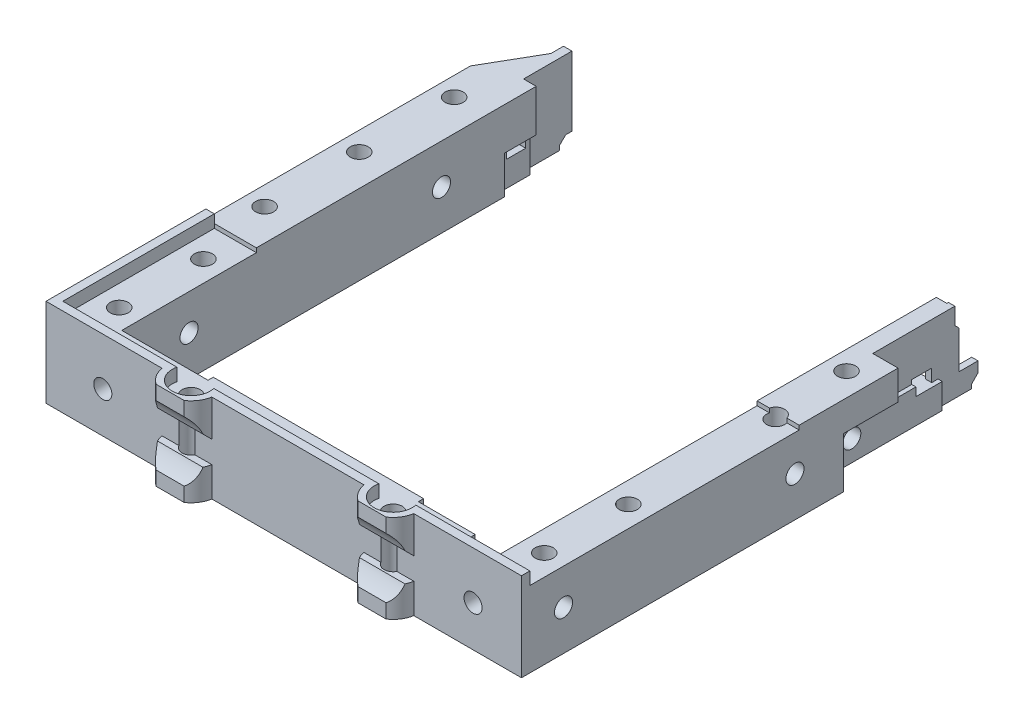
from build123d import *

# Parameters (mm, degrees)
EXTRUDE_1_DEPTH                  = 18
SKETCH_3_R                       = 2.15
CUT_EXTRUDE_1_DEPTH              = 110.787294347
SKETCH_4_W                       = 7.5
SKETCH_4_H                       = 18
CUT_EXTRUDE_2_DEPTH              = 6
CUT_EXTRUDE_3_REACH              = 147.925
SKETCH_5_W                       = 15
SKETCH_5_H                       = 12
CUT_EXTRUDE_4_REACH              = 143.414
SKETCH_6_W                       = 2
SKETCH_6_H                       = 9
SKETCH_7_W                       = 10
SKETCH_7_H                       = 61
EXTRUDE_2_DEPTH                  = 1
SKETCH_8_W                       = 61
SKETCH_8_H                       = 19
EXTRUDE_3_DEPTH                  = 4
SKETCH_9_W                       = 42
SKETCH_9_H                       = 19
EXTRUDE_4_DEPTH                  = 2
SKETCH_10_R                      = 2.15
CUT_EXTRUDE_5_DEPTH              = 6
SKETCH_11_W                      = 50
SKETCH_11_H                      = 18
EXTRUDE_5_DEPTH                  = 1.25
EXTRUDE_START                    = 1
SKETCH_12_R                      = 2.15
EXTRUDE_6_DEPTH                  = 1
SKETCH_13_W                      = 7
SKETCH_13_H                      = 2
CUT_EXTRUDE_6_DEPTH              = 18
CUT_EXTRUDE_7_DEPTH              = 112.862638982
CUT_EXTRUDE_7_DEPTH_BACK         = 112.862638982
EXTRUDE_7_DEPTH                  = 1
SKETCH_18_R                      = 2.15
CUT_EXTRUDE_8_DEPTH              = 6
SKETCH_19_R                      = 2.15
CUT_EXTRUDE_9_DEPTH              = 112.055166471
CUT_EXTRUDE_10_DEPTH             = 112.167666162
CUT_EXTRUDE_10_DEPTH_BACK        = 112.167666162
SKETCH_20_R                      = 2.15
SKETCH_23_W                      = 2
SKETCH_23_H                      = 19
CUT_EXTRUDE_11_DEPTH             = 88.305498109
EXTRUDE_10_DEPTH                 = 3
CUT_EXTRUDE_13_DEPTH             = 1.5
EXTRUDE_11_DEPTH                 = 1
SKETCH_29_W                      = 4.158947633
SKETCH_29_H                      = 12
EXTRUDE_12_DEPTH                 = 1
FILLET_1_R                       = 1
CUT_EXTRUDE_14_REACH             = 154.509
EXTRUDE_13_DEPTH                 = 1.5
EXTRUDE_14_REACH                 = 155.565
SKETCH_32_W                      = 1.75
SKETCH_32_H                      = 3
CHAMFER_1_SIZE2                  = 1
CHAMFER_1_SIZE                   = 1.732050808
SKETCH_33_R                      = 2.15
EXTRUDE_16_DEPTH                 = 19
CUT_EXTRUDE_15_REACH             = 126.256
SKETCH_34_R                      = 2.15
EXTRUDE_18_DEPTH                 = 12
CUT_EXTRUDE_16_DEPTH             = 1.75
SKETCH_39_W                      = 19
SKETCH_39_H                      = 9
CUT_EXTRUDE_17_DEPTH             = 1.5
CHAMFER_2_SIZE                   = 1.5
CUT_EXTRUDE_18_DEPTH             = 1.5
CUT_EXTRUDE_18_DEPTH_BACK        = 1.5
SKETCH_40_W                      = 11.5
SKETCH_40_H                      = 19
CUT_EXTRUDE_19_DEPTH             = 7
CHAMFER_3_SIZE                   = 7
CHAMFER_3_SIZE_2                 = 12.124355653
CUT_EXTRUDE_20_REACH             = 126.524
SKETCH_43_W                      = 4.5
SKETCH_43_H                      = 7
CUT_EXTRUDE_21_DEPTH             = 0.7
FILLET_2_R                       = 2
CUT_EXTRUDE_22_REACH             = 156.145
CUT_EXTRUDE_22_DIRECTION_2_REACH = 156.145
EXTRUDE_19_DEPTH                 = 0.7
SKETCH_46_W                      = 0.5
SKETCH_46_H                      = 3
EXTRUDE_20_DEPTH                 = 1.5
SKETCH_47_W                      = 1
SKETCH_47_H                      = 3
EXTRUDE_21_DEPTH                 = 4.5
CUT_EXTRUDE_23_REACH             = 156.629
SKETCH_48_W                      = 2
SKETCH_48_H                      = 11
FILLET_3_R                       = 0.5
EXTRUDE_22_DEPTH                 = 2.5
SKETCH_50_W                      = 2.5
SKETCH_50_H                      = 8
EXTRUDE_23_DEPTH                 = 1.5
CUT_EXTRUDE_24_REACH             = 155.594
SKETCH_51_W                      = 1
SKETCH_51_H                      = 5
CHAMFER_4_SIZE                   = 1
EXTRUDE_25_DEPTH                 = 12
CUT_EXTRUDE_25_REACH             = 157.322
SKETCH_53_R                      = 2.15
CUT_EXTRUDE_26_REACH             = 127.568
SKETCH_54_R                      = 2.15
SKETCH_55_R                      = 2.15
CUT_EXTRUDE_27_DEPTH             = 12
SKETCH_56_R                      = 2.15
CUT_EXTRUDE_28_DEPTH             = 10
CUT_EXTRUDE_29_REACH             = 160.84
SKETCH_57_R                      = 10
CUT_EXTRUDE_30_REACH             = 160.84
SKETCH_58_W                      = 1.6
SKETCH_58_H                      = 6.823488844
CHAMFER_5_SIZE                   = 1.6
EXTRUDE_26_DEPTH                 = 2
EXTRUDE_27_DEPTH                 = 3
CUT_EXTRUDE_31_REACH             = 133.161
SKETCH_61_R                      = 2.15
SKETCH_62_W                      = 7.75
SKETCH_62_H                      = 2
EXTRUDE_28_DEPTH                 = 1


# Some blends are built 0.0001 mm under size
with BuildPart() as part:
    # 草图2 → 凸台-拉伸1 (new body)
    with BuildSketch(Plane(origin=(0, 0, 0), x_dir=(1, 0, 0), z_dir=(0, 1, 0))):
        Polygon((-45.5, 0), (45.5, 0), (45.5, 93), (55.5, 93), (55.5, -10), (-55.5, -10), (-55.5, 93), (-45.5, 93), align=None)
    extrude(amount=EXTRUDE_1_DEPTH)

    # 草图3 → 切除-拉伸1 (cut, through all)
    with BuildSketch(Plane(origin=(0, 18, 0), x_dir=(1, 0, 0), z_dir=(0, 1, 0))):
        with Locations(Location((50, 76.75, 0), (0, 0, 270))):
            Circle(SKETCH_3_R)
    extrude(amount=-CUT_EXTRUDE_1_DEPTH, mode=Mode.SUBTRACT)

    # 草图4 → 切除-拉伸2 (cut)
    with BuildSketch(Plane(origin=(55.5, 0, 0), x_dir=(0, 0, -1), z_dir=(1, 0, 0))):
        with Locations((89.25, 9)):
            Rectangle(SKETCH_4_W, SKETCH_4_H)
    extrude(amount=-CUT_EXTRUDE_2_DEPTH, mode=Mode.SUBTRACT)

    # 切除-拉伸3: up to this face of the body (flat: up to its plane)
    cut_extrude_3_end = Plane(part.part.faces().sort_by_distance((49.5, 9, -89.25))[0])
    # 草图5 → 切除-拉伸3 (cut, up to the picked face)
    with BuildSketch(Plane(origin=(55.5, 0, 0), x_dir=(0, 0, -1), z_dir=(1, 0, 0)), mode=Mode.PRIVATE) as cut_extrude_3_sk1:
        with Locations((78, 6)):
            Rectangle(SKETCH_5_W, SKETCH_5_H)
    cut_extrude_3_tool1 = split(extrude(cut_extrude_3_sk1.sketch, amount=-CUT_EXTRUDE_3_REACH, mode=Mode.PRIVATE), bisect_by=cut_extrude_3_end, keep=Keep.BOTH, mode=Mode.PRIVATE)
    add(cut_extrude_3_tool1.solids().sort_by(Axis((55.5, 6, -78), (-1, 0, 0)))[0], mode=Mode.SUBTRACT)

    # 草图6 → 切除-拉伸4 (cut, up to next)
    with BuildSketch(Plane(origin=(49.5, 0, 0), x_dir=(0, 0, -1), z_dir=(1, 0, 0)), mode=Mode.PRIVATE) as cut_extrude_4_sk1:
        with Locations((92, 4.5)):
            Rectangle(SKETCH_6_W, SKETCH_6_H)
    cut_extrude_4_tool1 = extrude(cut_extrude_4_sk1.sketch, amount=-CUT_EXTRUDE_4_REACH, mode=Mode.PRIVATE) & part.part
    add(cut_extrude_4_tool1.solids().sort_by_distance((49.5, 4.5, -92))[0], mode=Mode.SUBTRACT)

    # 草图7 → 凸台-拉伸2 (add)
    with BuildSketch(Plane(origin=(0, 18, 0), x_dir=(1, 0, 0), z_dir=(0, 1, 0))):
        with Locations((-50.5, 62.5)):
            Rectangle(SKETCH_7_W, SKETCH_7_H)
    extrude(amount=EXTRUDE_2_DEPTH)

    # 草图8 → 凸台-拉伸3 (add)
    with BuildSketch(Plane.ZY.offset(55.5)):
        with Locations((-62.5, 9.5)):
            Rectangle(SKETCH_8_W, SKETCH_8_H)
    extrude(amount=EXTRUDE_3_DEPTH)

    # 草图9 → 凸台-拉伸4 (add)
    with BuildSketch(Plane.ZY.offset(55.5)):
        with Locations((-11, 9.5)):
            Rectangle(SKETCH_9_W, SKETCH_9_H)
    extrude(amount=EXTRUDE_4_DEPTH)

    # 草图10 → 切除-拉伸5 (cut)
    with BuildSketch(Plane(origin=(0, 18, 0), x_dir=(1, 0, 0), z_dir=(0, 1, 0))):
        with Locations(Location((-50.5, 4.4, 0), (0, 0, 270))):
            Circle(SKETCH_10_R)
        with Locations(Location((-50.5, 24.4, 0), (0, 0, 270))):
            Circle(SKETCH_10_R)
        with Locations(Location((-24, -5, 0), (0, 0, 270))):
            Circle(SKETCH_10_R)
        with Locations(Location((24, -5, 0), (0, 0, 270))):
            Circle(SKETCH_10_R)
    extrude(amount=-CUT_EXTRUDE_5_DEPTH, mode=Mode.SUBTRACT)

    # 草图11 → 凸台-拉伸5 (add)
    with BuildSketch(Plane(origin=(0, 0, 0), x_dir=(-1, 0, 0), z_dir=(0, 0, -1))):
        with Locations((0, 9)):
            Rectangle(SKETCH_11_W, SKETCH_11_H)
    extrude(amount=EXTRUDE_5_DEPTH)

    # 草图12 → 凸台-拉伸6 (add)
    with BuildSketch(Plane(origin=(0, 18, 0), x_dir=(1, 0, 0), z_dir=(0, 1, 0)).offset(EXTRUDE_START)):
        Polygon((49.5, 93), (45.5, 93), (45.5, 60), (55.5, 60), (55.5, 85.5), (49.5, 85.5), align=None)
        with Locations(Location((50, 76.75, 0), (0, 0, 270))):
            Circle(SKETCH_12_R, mode=Mode.SUBTRACT)
    extrude(amount=-EXTRUDE_6_DEPTH)

    # 草图13 → 切除-拉伸6 (cut)
    with BuildSketch(Plane(origin=(0, 18, 0), x_dir=(1, 0, 0), z_dir=(0, 1, 0))):
        with Locations((42, -1)):
            Rectangle(SKETCH_13_W, SKETCH_13_H)
    extrude(amount=-CUT_EXTRUDE_6_DEPTH, mode=Mode.SUBTRACT)

    # 草图14 → 切除-拉伸7 (cut, two sides: drawn at the far end of the back side and taken through both)
    with BuildSketch(Plane(origin=(0, 18, 0), x_dir=(1, 0, 0), z_dir=(0, 1, 0)).offset(-CUT_EXTRUDE_7_DEPTH_BACK)):
        with BuildLine():
            Line((-57.5, -10), (-27.31662479, -10))
            ThreePointArc((-27.31662479, -10), (-29.030974899, -8.269448205), (-29.916079783, -6))
            Line((-29.916079783, -6), (-57.5, -6))
            Line((-57.5, -6), (-57.5, -10))
        make_face()
        with BuildLine():
            Line((55.5, -10), (55.5, -6))
            Line((55.5, -6), (29.916079783, -6))
            ThreePointArc((29.916079783, -6), (29.030974899, -8.269448205), (27.31662479, -10))
            Line((27.31662479, -10), (55.5, -10))
        make_face()
        with BuildLine():
            Line((-18.083920217, -6), (18.083920217, -6))
            ThreePointArc((18.083920217, -6), (18.969025101, -8.269448205), (20.68337521, -10))
            Line((20.68337521, -10), (-20.68337521, -10))
            ThreePointArc((-20.68337521, -10), (-18.969025101, -8.269448205), (-18.083920217, -6))
        make_face()
    extrude(amount=CUT_EXTRUDE_7_DEPTH + CUT_EXTRUDE_7_DEPTH_BACK, mode=Mode.SUBTRACT)

    # 草图16 → 凸台-拉伸7 (add)
    with BuildSketch(Plane(origin=(0, 18, 0), x_dir=(1, 0, 0), z_dir=(0, 1, 0))):
        with BuildLine():
            Line((-55.5, -6), (-29.916079783, -6))
            ThreePointArc((-29.916079783, -6), (-30, -5), (-29.916079783, -4))
            Line((-29.916079783, -4), (-55.5, -4))
            Line((-55.5, -4), (-55.5, -6))
        make_face()
        with BuildLine():
            Line((55.5, -6), (55.5, -4))
            Line((55.5, -4), (29.916079783, -4))
            ThreePointArc((29.916079783, -4), (30, -5), (29.916079783, -6))
            Line((29.916079783, -6), (55.5, -6))
        make_face()
        with BuildLine():
            Line((-18.083920217, -4), (18.083920217, -4))
            ThreePointArc((18.083920217, -4), (18, -5), (18.083920217, -6))
            Line((18.083920217, -6), (-18.083920217, -6))
            ThreePointArc((-18.083920217, -6), (-18, -5), (-18.083920217, -4))
        make_face()
    extrude(amount=EXTRUDE_7_DEPTH)

    # 草图18 → 切除-拉伸8 (cut)
    with BuildSketch(Plane(origin=(0, 19, 0), x_dir=(1, 0, 0), z_dir=(0, 1, 0))):
        with Locations(Location((-53, 86.45, 0), (0, 0, 270))):
            Circle(SKETCH_18_R)
        with Locations(Location((-53, 63.95, 0), (0, 0, 270))):
            Circle(SKETCH_18_R)
        with Locations(Location((-53, 41.45, 0), (0, 0, 270))):
            Circle(SKETCH_18_R)
    extrude(amount=-CUT_EXTRUDE_8_DEPTH, mode=Mode.SUBTRACT)

    # 草图19 → 切除-拉伸9 (cut, through all)
    with BuildSketch(Plane(origin=(0, 12, 0), x_dir=(1, 0, 0), z_dir=(0, 1, 0))):
        with Locations(Location((24, -5, 0), (0, 0, 270))):
            Circle(SKETCH_19_R)
        with Locations(Location((-24, -5, 0), (0, 0, 270))):
            Circle(SKETCH_19_R)
    extrude(amount=-CUT_EXTRUDE_9_DEPTH, mode=Mode.SUBTRACT)

    # 草图20 → 切除-拉伸10 (cut, two sides: drawn at the far end of the back side and taken through both)
    with BuildSketch(Plane(origin=(0, 13, 0), x_dir=(1, 0, 0), z_dir=(0, 1, 0)).offset(-CUT_EXTRUDE_10_DEPTH_BACK)):
        with Locations(Location((-50.5, 4.4, 0), (0, 0, 270))):
            Circle(SKETCH_20_R)
        with Locations(Location((-50.5, 24.4, 0), (0, 0, 270))):
            Circle(SKETCH_20_R)
        with Locations(Location((-53, 41.45, 0), (0, 0, 270))):
            Circle(SKETCH_20_R)
        with Locations(Location((-53, 63.95, 0), (0, 0, 270))):
            Circle(SKETCH_20_R)
        with Locations(Location((-53, 86.45, 0), (0, 0, 270))):
            Circle(SKETCH_20_R)
        with Locations(Location((50.5, 24.4, 0), (0, 0, 270))):
            Circle(SKETCH_20_R)
        with Locations(Location((50.5, 4.4, 0), (0, 0, 270))):
            Circle(SKETCH_20_R)
    extrude(amount=CUT_EXTRUDE_10_DEPTH + CUT_EXTRUDE_10_DEPTH_BACK, mode=Mode.SUBTRACT)

    # 草图23 → 切除-拉伸11 (cut, through all)
    with BuildSketch(Plane.XY.offset(-32)):
        with Locations((-58.5, 9.5)):
            Rectangle(SKETCH_23_W, SKETCH_23_H)
    extrude(amount=-CUT_EXTRUDE_11_DEPTH, mode=Mode.SUBTRACT)

    # 草图26 → 凸台-拉伸10 (add)
    with BuildSketch(Plane(origin=(49.5, 0, 0), x_dir=(0, 0, -1), z_dir=(1, 0, 0))):
        Polygon((91, 0), (91, 6), (98, 6), (98, 9), (93, 9), (93, 19), (107, 19), (107, 0), align=None)
    extrude(amount=-EXTRUDE_10_DEPTH)

    # 草图27 → 切除-拉伸13 (cut)
    with BuildSketch(Plane.ZY.offset(-46.5)):
        Polygon((-98, 13), (-98, 0), (-107, 0), (-107, 19), (-101.464101615, 19), align=None)
    extrude(amount=-CUT_EXTRUDE_13_DEPTH, mode=Mode.SUBTRACT)

    # 草图28 → 凸台-拉伸11 (add)
    with BuildSketch(Plane.ZY.offset(-46.5)):
        Polygon((-101.464101615, 19), (-98, 13), (-98, 9), (-93, 9), (-93, 19), align=None)
    extrude(amount=EXTRUDE_11_DEPTH)

    # 草图29 → 凸台-拉伸12 (add)
    with BuildSketch(Plane(origin=(49.5, 0, 0), x_dir=(0, 0, -1), z_dir=(1, 0, 0))):
        Polygon((85.5, 12), (85.5, 6), (99, 6), (99, 0), (78.841052367, 0), (78.841052367, 12), align=None)
        with Locations((72.579473817, 6)):
            Rectangle(SKETCH_29_W, SKETCH_29_H)
    extrude(amount=EXTRUDE_12_DEPTH)

    # 圆角1
    fillet_1_edges = [part.edges().sort_by_distance(p)[0] for p in [
        (50, 6, -85.5),
    ]]
    fillet(fillet_1_edges, radius=FILLET_1_R)

    # 草图30 → 切除-拉伸14 (cut, up to next)
    with BuildSketch(Plane(origin=(49.5, 0, 0), x_dir=(0, 0, -1), z_dir=(1, 0, 0)), mode=Mode.PRIVATE) as cut_extrude_14_sk1:
        with BuildLine():
            Line((107, 11), (107, 19))
            Line((107, 19), (101.5, 19))
            Line((101.5, 19), (101.5, 12))
            ThreePointArc((101.5, 12), (101.792893219, 11.292893219), (102.5, 11))
            Line((102.5, 11), (107, 11))
        make_face()
    cut_extrude_14_tool1 = extrude(cut_extrude_14_sk1.sketch, amount=-CUT_EXTRUDE_14_REACH, mode=Mode.PRIVATE) & part.part
    add(cut_extrude_14_tool1.solids().sort_by_distance((49.5, 15.01851, -104.262384))[0], mode=Mode.SUBTRACT)

    # 草图31 → 凸台-拉伸13 (add)
    with BuildSketch(Plane(origin=(49.5, 0, 0), x_dir=(0, 0, -1), z_dir=(1, 0, 0))):
        Polygon((107, 1), (108.5, 2.5), (108.5, 11), (107, 11), align=None)
    extrude(amount=-EXTRUDE_13_DEPTH)

    # 凸台-拉伸14: up to this face of the body (flat: up to its plane)
    extrude_14_end = Plane(part.part.faces().sort_by_distance((45.5, 9.407551011, -47.316741338))[0])
    # 草图32 → 凸台-拉伸14 (add, up to the picked face)
    with BuildSketch(Plane(origin=(49.5, 0, 0), x_dir=(0, 0, -1), z_dir=(1, 0, 0)), mode=Mode.PRIVATE) as extrude_14_sk1:
        with Locations((91.875, 7.5)):
            Rectangle(SKETCH_32_W, SKETCH_32_H)
    extrude_14_tool1 = split(extrude(extrude_14_sk1.sketch, amount=-EXTRUDE_14_REACH, mode=Mode.PRIVATE), bisect_by=extrude_14_end, keep=Keep.BOTH, mode=Mode.PRIVATE)
    add(extrude_14_tool1.solids().sort_by(Axis((49.5, 7.5, -91.875), (-1, 0, 0)))[0])

    # 倒角1
    chamfer_1_edges = [part.edges().sort_by_distance(p)[0] for p in [
        (45.5, 6, -91.875),
    ]]
    chamfer_1_side = [part.faces().sort_by_distance(p)[0] for p in [
        (45.5, 6.02, -91.875),
    ]]
    chamfer(chamfer_1_edges, length=CHAMFER_1_SIZE - 0.0001, length2=CHAMFER_1_SIZE2 - 0.0001, reference=chamfer_1_side[0])  # a hair under: the kernel refuses the full size

    # 草图33 → 凸台-拉伸16 (add)
    with BuildSketch(Plane(origin=(0, 19, 0), x_dir=(1, 0, 0), z_dir=(0, 1, 0))):
        with Locations((-53, 86.45)):
            Circle(SKETCH_33_R)
    extrude(amount=-EXTRUDE_16_DEPTH)

    # 草图34 → 切除-拉伸15 (cut, up to next)
    with BuildSketch(Plane(origin=(0, 19, 0), x_dir=(1, 0, 0), z_dir=(0, 1, 0)), mode=Mode.PRIVATE) as cut_extrude_15_sk1:
        with Locations(Location((-53, 86.5, 0), (0, 0, 270))):
            Circle(SKETCH_34_R)
    cut_extrude_15_tool1 = extrude(cut_extrude_15_sk1.sketch, amount=-CUT_EXTRUDE_15_REACH, mode=Mode.PRIVATE) & part.part
    add(cut_extrude_15_tool1.solids().sort_by_distance((-53, 19, -86.5))[0], mode=Mode.SUBTRACT)

    # 草图36 → 凸台-拉伸18 (add)
    with BuildSketch(Plane.ZY.offset(57.5)):
        Polygon((-93, 6), (-98.5, 6), (-98.5, 9), (-93, 9), (-93, 19), (-110, 19), (-110, 2.5), (-108.5, 2.5), (-107, 1), (-107, 0), (-93, 0), align=None)
    extrude(amount=-EXTRUDE_18_DEPTH)

    # 草图38 → 切除-拉伸16 (cut)
    with BuildSketch(Plane(origin=(0, 0, -92.75), x_dir=(-1, 0, 0), z_dir=(0, 0, -1))):
        Polygon((-46.5, 6), (-46.5, 8), (-45.5, 9), (-45.5, 6), align=None)
    extrude(amount=-CUT_EXTRUDE_16_DEPTH, mode=Mode.SUBTRACT)

    # 草图39 → 切除-拉伸17 (cut)
    with BuildSketch(Plane(origin=(-45.5, 0, 0), x_dir=(0, 0, -1), z_dir=(1, 0, 0))):
        with Locations((100.5, 4.5)):
            Rectangle(SKETCH_39_W, SKETCH_39_H)
    extrude(amount=-CUT_EXTRUDE_17_DEPTH, mode=Mode.SUBTRACT)

    # 倒角2
    chamfer_2_edges = [part.edges().sort_by_distance(p)[0] for p in [
        (-47, 9, -92),
    ]]
    chamfer(chamfer_2_edges, length=CHAMFER_2_SIZE - 0.0001)  # a hair under: the kernel refuses the full size

    # 草图40 → 切除-拉伸18 (cut, two sides: drawn at the far end of the back side and taken through both)
    with BuildSketch(Plane(origin=(-47, 0, 0), x_dir=(0, 0, -1), z_dir=(1, 0, 0)).offset(-CUT_EXTRUDE_18_DEPTH_BACK)):
        with Locations((104.25, 9.5)):
            Rectangle(SKETCH_40_W, SKETCH_40_H)
    extrude(amount=CUT_EXTRUDE_18_DEPTH + CUT_EXTRUDE_18_DEPTH_BACK, mode=Mode.SUBTRACT)

    # 草图41 → 切除-拉伸19 (cut)
    with BuildSketch(Plane.ZY.offset(57.5)):
        Polygon((-107, 19), (-107, 0), (-110, 2.5), (-110, 19), align=None)
    extrude(amount=-CUT_EXTRUDE_19_DEPTH, mode=Mode.SUBTRACT)

    # 倒角3
    # the kernel refuses this chamfer: 12.124355653, 7 mm, written as the material it takes off along each edge
    with BuildSketch(Plane(origin=(-57.5, -31.366747794, -107), x_dir=(0.9983227437537926, 0, -0.05789386240267121), z_dir=(0, 1, 0))) as chamfer_3_piece_1:
        Polygon((CHAMFER_3_SIZE * 0.998322743754, -CHAMFER_3_SIZE * 0.0578938624027), (-CHAMFER_3_SIZE_2 * 0.0578938624026, -CHAMFER_3_SIZE_2 * 0.998322743752), (0, 0), align=None)
    extrude(amount=81.733495588, mode=Mode.SUBTRACT)

    # 草图42 → 切除-拉伸20 (cut, up to next)
    with BuildSketch(Plane.XZ.offset(-9), mode=Mode.PRIVATE) as cut_extrude_20_sk1:
        Polygon((-51.5, -93), (-51.5, -105.267949192), (-57.5, -94.875644347), (-57.5, -93), align=None)
    cut_extrude_20_tool1 = extrude(cut_extrude_20_sk1.sketch, amount=CUT_EXTRUDE_20_REACH, mode=Mode.PRIVATE) & part.part
    add(cut_extrude_20_tool1.solids().sort_by_distance((-53.765229, 9, -97.172229))[0], mode=Mode.SUBTRACT)

    # 草图43 → 切除-拉伸21 (cut)
    with BuildSketch(Plane(origin=(49.5, 0, 0), x_dir=(0, 0, -1), z_dir=(1, 0, 0))):
        with Locations((106.25, 7.5)):
            Rectangle(SKETCH_43_W, SKETCH_43_H)
    extrude(amount=-CUT_EXTRUDE_21_DEPTH, mode=Mode.SUBTRACT)

    # 圆角2
    fillet_2_edges = [part.edges().sort_by_distance(p)[0] for p in [
        (49.15, 4, -104),
    ]]
    fillet(fillet_2_edges, radius=FILLET_2_R)

    # 草图44 → 切除-拉伸22 (cut, up to next)
    with BuildSketch(Plane(origin=(48.8, 0, 0), x_dir=(0, 0, -1), z_dir=(1, 0, 0)), mode=Mode.PRIVATE) as cut_extrude_22_sk1:
        Polygon((108.5, 5), (104, 5), (104, 6), (104, 11), (108.5, 11), align=None)
    cut_extrude_22_tool1 = extrude(cut_extrude_22_sk1.sketch, amount=-CUT_EXTRUDE_22_REACH, mode=Mode.PRIVATE) & part.part
    add(cut_extrude_22_tool1.solids().sort_by_distance((48.8, 8, -106.25))[0], mode=Mode.SUBTRACT)

    # 草图44 → 切除-拉伸22 direction 2 (cut, up to next)
    with BuildSketch(Plane(origin=(48.8, 0, 0), x_dir=(0, 0, -1), z_dir=(1, 0, 0)), mode=Mode.PRIVATE) as cut_extrude_22_direction_2_sk1:
        Polygon((108.5, 5), (104, 5), (104, 6), (104, 11), (108.5, 11), align=None)
    cut_extrude_22_direction_2_tool1 = extrude(cut_extrude_22_direction_2_sk1.sketch, amount=CUT_EXTRUDE_22_DIRECTION_2_REACH, mode=Mode.PRIVATE) & part.part
    add(cut_extrude_22_direction_2_tool1.solids().sort_by_distance((48.8, 8, -106.25))[0], mode=Mode.SUBTRACT)

    # 草图45 → 凸台-拉伸19 (add)
    with BuildSketch(Plane(origin=(48.8, 0, 0), x_dir=(0, 0, -1), z_dir=(1, 0, 0))):
        with BuildLine():
            Line((108.5, 5), (104.267949192, 5))
            ThreePointArc((104.267949192, 5), (105, 4.267949192), (106, 4))
            Line((106, 4), (108.5, 4))
            Line((108.5, 4), (108.5, 5))
        make_face()
    extrude(amount=EXTRUDE_19_DEPTH)

    # 草图46 → 凸台-拉伸20 (add)
    with BuildSketch(Plane(origin=(49.5, 0, 0), x_dir=(0, 0, -1), z_dir=(1, 0, 0))):
        with Locations((97.75, 7.5)):
            Rectangle(SKETCH_46_W, SKETCH_46_H)
    extrude(amount=-EXTRUDE_20_DEPTH)

    # 草图47 → 凸台-拉伸21 (add)
    with BuildSketch(Plane.ZY.offset(51.5)):
        with Locations((-98, 7.5)):
            Rectangle(SKETCH_47_W, SKETCH_47_H)
    extrude(amount=-EXTRUDE_21_DEPTH)

    # 草图48 → 切除-拉伸23 (cut, up to next)
    with BuildSketch(Plane(origin=(49.5, 0, 0), x_dir=(0, 0, -1), z_dir=(1, 0, 0)), mode=Mode.PRIVATE) as cut_extrude_23_sk1:
        with Locations((84.5, 13.5)):
            Rectangle(SKETCH_48_W, SKETCH_48_H)
    cut_extrude_23_tool1 = extrude(cut_extrude_23_sk1.sketch, amount=CUT_EXTRUDE_23_REACH, mode=Mode.PRIVATE) & part.part
    add(cut_extrude_23_tool1.solids().sort_by_distance((49.5, 13.5, -84.5))[0], mode=Mode.SUBTRACT)

    # 圆角3
    fillet_3_edges = [part.edges().sort_by_distance(p)[0] for p in [
        (50, 8, -85.5),
        (50, 8, -83.5),
    ]]
    fillet(fillet_3_edges, radius=FILLET_3_R)

    # 草图49 → 凸台-拉伸22 (add)
    with BuildSketch(Plane.ZY.offset(-48)):
        Polygon((-98, 11), (-102.618802154, 19), (-101.464101615, 19), (-98, 13), align=None)
    extrude(amount=EXTRUDE_22_DEPTH)

    # 草图50 → 凸台-拉伸23 (add)
    with BuildSketch(Plane(origin=(49.5, 0, 0), x_dir=(0, 0, -1), z_dir=(1, 0, 0))):
        with Locations((102.75, 15)):
            Rectangle(SKETCH_50_W, SKETCH_50_H)
    extrude(amount=-EXTRUDE_23_DEPTH)

    # 草图51 → 切除-拉伸24 (cut, up to next)
    with BuildSketch(Plane.ZY.offset(-48), mode=Mode.PRIVATE) as cut_extrude_24_sk1:
        with Locations((-103.5, 16.5)):
            Rectangle(SKETCH_51_W, SKETCH_51_H)
    cut_extrude_24_tool1 = extrude(cut_extrude_24_sk1.sketch, amount=-CUT_EXTRUDE_24_REACH, mode=Mode.PRIVATE) & part.part
    add(cut_extrude_24_tool1.solids().sort_by_distance((48, 16.5, -103.5))[0], mode=Mode.SUBTRACT)

    # 倒角4
    chamfer_4_edges = [part.edges().sort_by_distance(p)[0] for p in [
        (48.75, 14, -103),
    ]]
    chamfer(chamfer_4_edges, length=CHAMFER_4_SIZE - 0.0001)  # a hair under: the kernel refuses the full size

    # 草图52 → 凸台-拉伸25 (add)
    with BuildSketch(Plane.XZ):
        with BuildLine():
            Line((50.5, -73.791960108), (50.5, -79.708039892))
            ThreePointArc((50.5, -79.708039892), (47, -76.75), (50.5, -73.791960108))
        make_face()
    extrude(amount=-EXTRUDE_25_DEPTH)

    # 草图53 → 切除-拉伸25 (cut, up to next)
    with BuildSketch(Plane(origin=(50.5, 0, 0), x_dir=(0, 0, -1), z_dir=(1, 0, 0)), mode=Mode.PRIVATE) as cut_extrude_25_sk1:
        with Locations((77.5, 5)):
            Circle(SKETCH_53_R)
    cut_extrude_25_tool1 = extrude(cut_extrude_25_sk1.sketch, amount=-CUT_EXTRUDE_25_REACH, mode=Mode.PRIVATE) & part.part
    add(cut_extrude_25_tool1.solids().sort_by_distance((50.5, 5, -77.5))[0], mode=Mode.SUBTRACT)

    # 草图54 → 切除-拉伸26 (cut, up to next)
    with BuildSketch(Plane.XZ, mode=Mode.PRIVATE) as cut_extrude_26_sk1:
        with Locations(Location((50.5, -59.4, 0), (0, 0, 270))):
            Circle(SKETCH_54_R)
    cut_extrude_26_tool1 = extrude(cut_extrude_26_sk1.sketch, amount=-CUT_EXTRUDE_26_REACH, mode=Mode.PRIVATE) & part.part
    add(cut_extrude_26_tool1.solids().sort_by_distance((50.5, 0, -59.4))[0], mode=Mode.SUBTRACT)

    # 草图55 → 切除-拉伸27 (cut)
    with BuildSketch(Plane.ZY.offset(57.5)):
        with Locations((-76, 9.5)):
            Circle(SKETCH_55_R)
        with Locations((-16, 9.5)):
            Circle(SKETCH_55_R)
    extrude(amount=-CUT_EXTRUDE_27_DEPTH, mode=Mode.SUBTRACT)

    # 草图56 → 切除-拉伸28 (cut)
    with BuildSketch(Plane(origin=(55.5, 0, 0), x_dir=(0, 0, -1), z_dir=(1, 0, 0))):
        with Locations((4, 9.5)):
            Circle(SKETCH_56_R)
        with Locations((59, 9.5)):
            Circle(SKETCH_56_R)
    extrude(amount=-CUT_EXTRUDE_28_DEPTH, mode=Mode.SUBTRACT)

    # 切除-拉伸29: up to this face of the body (flat: up to its plane)
    cut_extrude_29_end = Plane(part.part.faces().sort_by_distance((-57.5, 9.545118638, -43.966893837))[0])
    # 草图57 → 切除-拉伸29 (cut, up to the picked face)
    with BuildSketch(Plane(origin=(55.5, 0, 0), x_dir=(0, 0, -1), z_dir=(1, 0, 0)), mode=Mode.PRIVATE) as cut_extrude_29_sk1:
        with Locations((-17, 10.5)):
            Circle(SKETCH_57_R)
    cut_extrude_29_tool1 = split(extrude(cut_extrude_29_sk1.sketch, amount=-CUT_EXTRUDE_29_REACH, mode=Mode.PRIVATE), bisect_by=cut_extrude_29_end, keep=Keep.BOTH, mode=Mode.PRIVATE)
    add(cut_extrude_29_tool1.solids().sort_by(Axis((55.5, 10.5, 17), (-1, 0, 0)))[0], mode=Mode.SUBTRACT)

    # 切除-拉伸30: up to this face of the body (flat: up to its plane)
    cut_extrude_30_end = Plane(part.part.faces().sort_by_distance((-57.5, 9.545118638, -43.966893837))[0])
    # 草图58 → 切除-拉伸30 (cut, up to the picked face)
    with BuildSketch(Plane(origin=(55.5, 0, 0), x_dir=(0, 0, -1), z_dir=(1, 0, 0)), mode=Mode.PRIVATE) as cut_extrude_30_sk1:
        with Locations((-6.8, 10.5)):
            Rectangle(SKETCH_58_W, SKETCH_58_H)
    cut_extrude_30_tool1 = split(extrude(cut_extrude_30_sk1.sketch, amount=-CUT_EXTRUDE_30_REACH, mode=Mode.PRIVATE), bisect_by=cut_extrude_30_end, keep=Keep.BOTH, mode=Mode.PRIVATE)
    add(cut_extrude_30_tool1.solids().sort_by(Axis((55.5, 10.5, 6.8), (-1, 0, 0)))[0], mode=Mode.SUBTRACT)

    # 倒角5
    # the kernel refuses this chamfer: 1.6 mm, written as the material it adds along each edge
    with BuildSketch(Plane(origin=(-21.78859385, 13.911744422, 6), x_dir=(0, -0.9996219169112968, -0.027495876610586285), z_dir=(-1, 0, 0))) as chamfer_5_piece_1_section:
        Polygon((CHAMFER_5_SIZE * 0.999621916911, CHAMFER_5_SIZE * 0.0274958766106), (-CHAMFER_5_SIZE * 0.0274958766106, CHAMFER_5_SIZE * 0.999621916911), (0, 0), align=None)
    chamfer_5_piece_1 = extrude(amount=12.242178714, mode=Mode.PRIVATE)
    chamfer_5_piece_1 = chamfer_5_piece_1 - Plane(origin=(-24, 13.422836747, 5), x_dir=(0, 0, 1), z_dir=(0, 1, 0)) * Cylinder(2.15, 31, mode=Mode.PRIVATE)
    chamfer_5_piece_1 = chamfer_5_piece_1 - Plane(origin=(-26.722058285, 10.5, 17), x_dir=(0, 0, -1), z_dir=(1, 0, 0)) * Cylinder(10, 31, mode=Mode.PRIVATE)
    chamfer_5_piece_1 = chamfer_5_piece_1 & Plane(origin=(-24, 13.422836747, 5), x_dir=(-0.5527707983925657, 0, 0.8333333333333339), z_dir=(0, -1, 0)) * Cylinder(6, 31, mode=Mode.PRIVATE)
    add(chamfer_5_piece_1)
    with BuildSketch(Plane(origin=(-13.969227436, 13.911744422, 6), x_dir=(0, -0.9996219169112968, -0.027495876610586285), z_dir=(-1, 0, 0))) as chamfer_5_piece_2_section:
        Polygon((CHAMFER_5_SIZE * 0.999621916911, CHAMFER_5_SIZE * 0.0274958766106), (-CHAMFER_5_SIZE * 0.0274958766106, CHAMFER_5_SIZE * 0.999621916911), (0, 0), align=None)
    chamfer_5_piece_2 = extrude(amount=12.242178714, mode=Mode.PRIVATE)
    chamfer_5_piece_2 = chamfer_5_piece_2 - Plane(origin=(-24, 13.422836749, 5), x_dir=(0, 0, 1), z_dir=(0, 1, 0)) * Cylinder(2.15, 31, mode=Mode.PRIVATE)
    chamfer_5_piece_2 = chamfer_5_piece_2 & Plane(origin=(-24, 13.422836749, 5), x_dir=(0.5527707983925676, 0, 0.8333333333333327), z_dir=(0, -1, 0)) * Cylinder(6, 31, mode=Mode.PRIVATE)
    chamfer_5_piece_2 = chamfer_5_piece_2 - Plane(origin=(-21.277941712, 10.5, 17), x_dir=(0, 0, -1), z_dir=(1, 0, 0)) * Cylinder(10, 31, mode=Mode.PRIVATE)
    add(chamfer_5_piece_2)
    with BuildSketch(Plane(origin=(26.21140615, 13.911744422, 6), x_dir=(0, -0.9996219169112968, -0.027495876610586285), z_dir=(-1, 0, 0))) as chamfer_5_piece_3_section:
        Polygon((CHAMFER_5_SIZE * 0.999621916911, CHAMFER_5_SIZE * 0.0274958766106), (-CHAMFER_5_SIZE * 0.0274958766106, CHAMFER_5_SIZE * 0.999621916911), (0, 0), align=None)
    chamfer_5_piece_3 = extrude(amount=12.242178714, mode=Mode.PRIVATE)
    chamfer_5_piece_3 = chamfer_5_piece_3 - Plane(origin=(24, 13.422836751, 5), x_dir=(0, 0, 1), z_dir=(0, 1, 0)) * Cylinder(2.15, 31, mode=Mode.PRIVATE)
    chamfer_5_piece_3 = chamfer_5_piece_3 & Plane(origin=(24, 13.422836751, 5), x_dir=(-0.986013297183269, 0, 0.16666666666666888), z_dir=(0, -1, 0)) * Cylinder(6, 31, mode=Mode.PRIVATE)
    chamfer_5_piece_3 = chamfer_5_piece_3 - Plane(origin=(21.277941714, 10.5, 17), x_dir=(0, 0, -1), z_dir=(1, 0, 0)) * Cylinder(10, 31, mode=Mode.PRIVATE)
    add(chamfer_5_piece_3)
    with BuildSketch(Plane(origin=(34.030772564, 13.911744422, 6), x_dir=(0, -0.9996219169112968, -0.027495876610586285), z_dir=(-1, 0, 0))) as chamfer_5_piece_4_section:
        Polygon((CHAMFER_5_SIZE * 0.999621916911, CHAMFER_5_SIZE * 0.0274958766106), (-CHAMFER_5_SIZE * 0.0274958766106, CHAMFER_5_SIZE * 0.999621916911), (0, 0), align=None)
    chamfer_5_piece_4 = extrude(amount=12.242178714, mode=Mode.PRIVATE)
    chamfer_5_piece_4 = chamfer_5_piece_4 & Plane(origin=(24, 13.422836752, 5), x_dir=(0.9860132971832691, 0, 0.16666666666666852), z_dir=(0, -1, 0)) * Cylinder(6, 31, mode=Mode.PRIVATE)
    chamfer_5_piece_4 = chamfer_5_piece_4 - Plane(origin=(24, 13.422836752, 5), x_dir=(0, 0, 1), z_dir=(0, 1, 0)) * Cylinder(2.15, 31, mode=Mode.PRIVATE)
    chamfer_5_piece_4 = chamfer_5_piece_4 - Plane(origin=(26.722058288, 10.5, 17), x_dir=(0, 0, -1), z_dir=(1, 0, 0)) * Cylinder(10, 31, mode=Mode.PRIVATE)
    add(chamfer_5_piece_4)

    # 草图59 → 凸台-拉伸26 (add)
    with BuildSketch(Plane(origin=(0, 19, 0), x_dir=(1, 0, 0), z_dir=(0, 1, 0))):
        with BuildLine():
            Line((-55.5, 32), (-57.5, 32))
            Line((-57.5, 32), (-57.5, -6))
            Line((-57.5, -6), (-29.916079783, -6))
            ThreePointArc((-29.916079783, -6), (-30, -5), (-29.916079783, -4))
            Line((-29.916079783, -4), (-55.5, -4))
            Line((-55.5, -4), (-55.5, 32))
        make_face()
        with BuildLine():
            Line((55.5, -6), (55.5, -4))
            Line((55.5, -4), (29.916079783, -4))
            ThreePointArc((29.916079783, -4), (30, -5), (29.916079783, -6))
            Line((29.916079783, -6), (55.5, -6))
        make_face()
        with BuildLine():
            Line((-18.083920217, -6), (18.083920217, -6))
            ThreePointArc((18.083920217, -6), (18, -5), (18.083920217, -4))
            Line((18.083920217, -4), (-18.083920217, -4))
            ThreePointArc((-18.083920217, -4), (-18, -5), (-18.083920217, -6))
        make_face()
    extrude(amount=EXTRUDE_26_DEPTH)

    # 草图60 → 凸台-拉伸27 (add)
    with BuildSketch(Plane(origin=(0, 18, 0), x_dir=(1, 0, 0), z_dir=(0, 1, 0))):
        with BuildLine():
            Line((-29.916079783, -4), (-28.387482194, -4))
            ThreePointArc((-28.387482194, -4), (-24, -9.5), (-19.612517806, -4))
            Line((-19.612517806, -4), (-18.083920217, -4))
            ThreePointArc((-18.083920217, -4), (-18.494483818, -7.385223588), (-20.68337521, -10))
            Line((-20.68337521, -10), (-27.31662479, -10))
            ThreePointArc((-27.31662479, -10), (-29.505516182, -7.385223588), (-29.916079783, -4))
        make_face()
        with BuildLine():
            Line((18.083920217, -4), (19.612517806, -4))
            ThreePointArc((19.612517806, -4), (24, -9.5), (28.387482194, -4))
            Line((28.387482194, -4), (29.916079783, -4))
            ThreePointArc((29.916079783, -4), (29.505516182, -7.385223588), (27.31662479, -10))
            Line((27.31662479, -10), (20.68337521, -10))
            ThreePointArc((20.68337521, -10), (18.494483818, -7.385223588), (18.083920217, -4))
        make_face()
    extrude(amount=EXTRUDE_27_DEPTH)

    # 切除-拉伸31: up to this face of the body (flat: up to its plane)
    cut_extrude_31_end = Plane(part.part.faces().sort_by_distance((-35.25, 9, 0))[0])
    # 草图61 → 切除-拉伸31 (cut, up to the picked face)
    with BuildSketch(Plane.XY.offset(6), mode=Mode.PRIVATE) as cut_extrude_31_sk1:
        with Locations((-44, 9.7)):
            Circle(SKETCH_61_R)
    cut_extrude_31_tool1 = split(extrude(cut_extrude_31_sk1.sketch, amount=-CUT_EXTRUDE_31_REACH, mode=Mode.PRIVATE), bisect_by=cut_extrude_31_end, keep=Keep.BOTH, mode=Mode.PRIVATE)
    # 草图61 → 切除-拉伸31 (cut, up to the picked face)
    with BuildSketch(Plane.XY.offset(6), mode=Mode.PRIVATE) as cut_extrude_31_sk2:
        with Locations((44, 9.7)):
            Circle(SKETCH_61_R)
    cut_extrude_31_tool2 = split(extrude(cut_extrude_31_sk2.sketch, amount=-CUT_EXTRUDE_31_REACH, mode=Mode.PRIVATE), bisect_by=cut_extrude_31_end, keep=Keep.BOTH, mode=Mode.PRIVATE)
    add(cut_extrude_31_tool1.solids().sort_by(Axis((-44, 9.7, 6), (0, 0, -1)))[0], mode=Mode.SUBTRACT)
    add(cut_extrude_31_tool2.solids().sort_by(Axis((44, 9.7, 6), (0, 0, -1)))[0], mode=Mode.SUBTRACT)

    # 草图62 → 凸台-拉伸28 (add)
    with BuildSketch(Plane(origin=(49.5, 0, 0), x_dir=(0, 0, -1), z_dir=(1, 0, 0))):
        with Locations((88.875, 7)):
            Rectangle(SKETCH_62_W, SKETCH_62_H)
    extrude(amount=EXTRUDE_28_DEPTH)


solid = part.part
